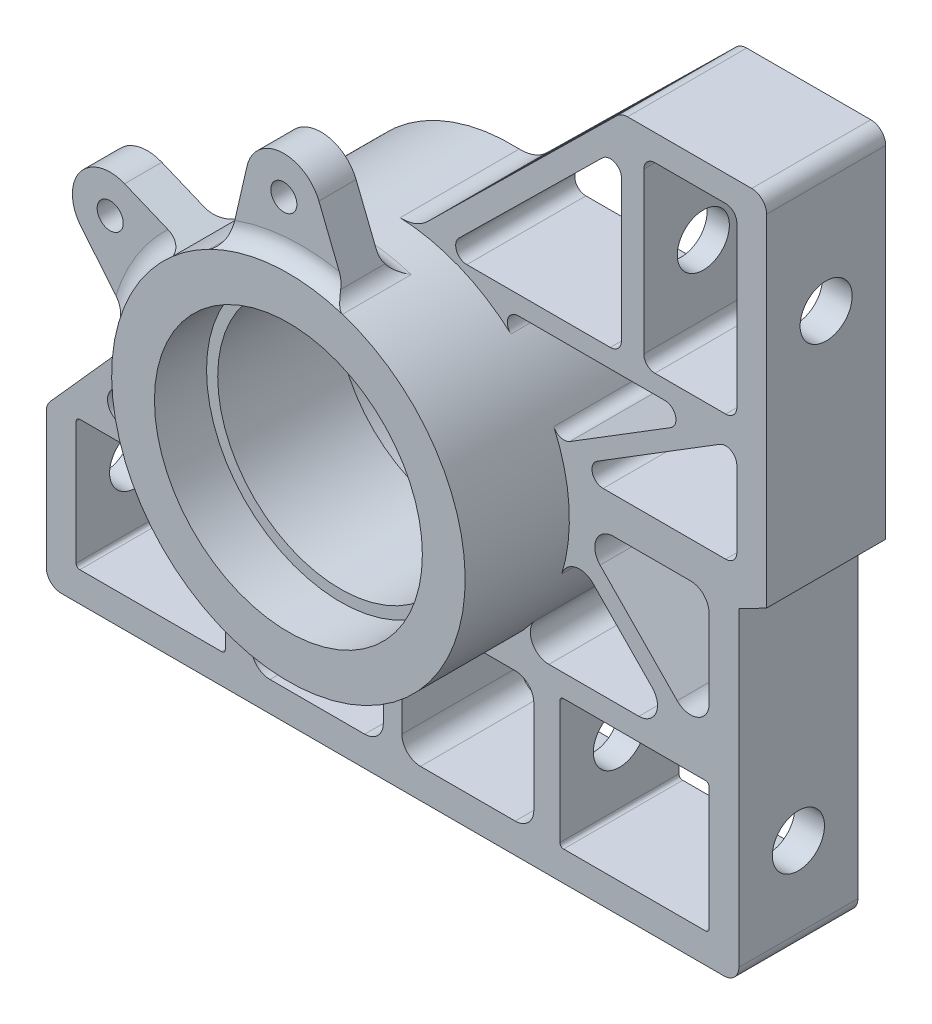
from build123d import *

# Parameters (mm, degrees)
SKETCH1_R                = 47.5
SKETCH1_R_2              = 36
BOSS_EXTRUDE1_DEPTH      = 60
BOSS_EXTRUDE2_DEPTH      = 32
FILLET4_R                = 10
CUT_EXTRUDE1_REACH       = 228.636
CUT_EXTRUDE2_DEPTH       = 64
BOSS_EXTRUDE4_DEPTH      = 16
BOSS_EXTRUDE4_DEPTH_BACK = 16
SKETCH6_R                = 36
SKETCH6_R_2              = 33
FILLET5_R                = 4
SKETCH8_R                = 10.15
SKETCH8_R_2              = 3.5
SKETCH8_R_3              = 10.147427291
BOSS_EXTRUDE6_DEPTH      = 10
FILLET12_R               = 5


with BuildPart() as part:
    # Sketch1 → Boss-Extrude1 (new body)
    with BuildSketch(Plane.XY):
        Circle(SKETCH1_R)
        Circle(SKETCH1_R_2, mode=Mode.SUBTRACT)
    extrude(amount=BOSS_EXTRUDE1_DEPTH)

    # Sketch2 → Boss-Extrude2 (add)
    with BuildSketch(Plane(origin=(0, 0, 0), x_dir=(-1, 0, 0), z_dir=(0, 0, -1))):
        with BuildLine():
            ThreePointArc((-93.05, -81.5), (-91.878427125, -84.328427125), (-89.05, -85.5))
            Line((-89.05, -85.5), (89.05, -85.5))
            ThreePointArc((89.05, -85.5), (91.878427125, -84.328427125), (93.05, -81.5))
            Line((93.05, -81.5), (93.05, -45.025163862))
            ThreePointArc((93.05, -45.025163862), (92.787529788, -43.60007752), (92.03456446, -42.362012536))
            Line((92.03456446, -42.362012536), (46.754425183, 8.382942549))
            ThreePointArc((46.754425183, 8.382942549), (47.313239142, 4.208016385), (47.5, 0))
            ThreePointArc((47.5, 0), (47.374726673, -3.447502376), (46.999567468, -6.876820327))
            ThreePointArc((46.999567468, -6.876820327), (46.85167785, -7.821143308), (46.684816708, -8.762299294))
            ThreePointArc((46.684816708, -8.762299294), (49.54342945, -5.646707476), (53.600734154, -6.837025804))
            Line((53.600734154, -6.837025804), (75.598988007, -31.49022744))
            ThreePointArc((75.598988007, -31.49022744), (76.264944422, -35.788523209), (72.614423548, -38.153378766))
            Line((72.614423548, -38.153378766), (49.95, -38.153378766))
            ThreePointArc((49.95, -38.153378766), (46.414466094, -36.688912672), (44.95, -33.153378766))
            Line((44.95, -33.153378766), (44.95, -15.354071121))
            ThreePointArc((44.95, -15.354071121), (44.659125276, -16.180622039), (44.353053198, -17.001666743))
            ThreePointArc((44.353053198, -17.001666743), (41.555802776, -23.00793897), (37.95, -28.566545118))
            Line((37.95, -28.566545118), (37.95, -72.533112291))
            ThreePointArc((37.95, -72.533112291), (36.47391714, -76.04722155), (32.950109644, -77.5))
            Line((32.950109644, -77.5), (7.5, -77.5))
            ThreePointArc((7.5, -77.5), (3.964466094, -76.035533906), (2.5, -72.5))
            Line((2.5, -72.5), (2.5, -47.434164903))
            ThreePointArc((2.5, -47.434164903), (0, -47.5), (-2.5, -47.434164903))
            Line((-2.5, -47.434164903), (-2.5, -72.5))
            ThreePointArc((-2.5, -72.5), (-3.964466094, -76.035533906), (-7.5, -77.5))
            Line((-7.5, -77.5), (-32.95, -77.5))
            ThreePointArc((-32.95, -77.5), (-36.485533906, -76.035533906), (-37.95, -72.5))
            Line((-37.95, -72.5), (-37.95, -47.5))
            ThreePointArc((-37.95, -47.5), (-36.485533906, -43.964466094), (-32.95, -42.5))
            Line((-32.95, -42.5), (-21.213203436, -42.5))
            ThreePointArc((-21.213203436, -42.5), (-27.890794752, -38.449363689), (-33.814356436, -33.359246077))
            ThreePointArc((-33.814356436, -33.359246077), (-35.989283345, -31.000346519), (-38, -28.5))
            ThreePointArc((-38, -28.5), (-37.527864045, -33.736067977), (-42, -36.5))
            Line((-42, -36.5), (-66.181051688, -36.5))
            ThreePointArc((-66.181051688, -36.5), (-70.789386546, -33.439909749), (-69.756953175, -28.005299934))
            Line((-69.756953175, -28.005299934), (-53.827303838, -11.705515781))
            ThreePointArc((-53.827303838, -11.705515781), (-49.062450426, -10.343633374), (-45.465554508, -13.752576243))
            ThreePointArc((-45.465554508, -13.752576243), (-47.40106961, 3.06408221), (-43.316596976, 19.491598868))
            ThreePointArc((-43.316596976, 19.491598868), (-45.175045505, 17.853800656), (-47.631663446, 18.171986466))
            Line((-47.631663446, 18.171986466), (-74.728376751, 34.949339249))
            ThreePointArc((-74.728376751, 34.949339249), (-76.034574712, 38.320980434), (-73.149095354, 40.5))
            Line((-73.149095354, 40.5), (-33.823069051, 40.5))
            ThreePointArc((-33.823069051, 40.5), (-31.022786179, 38.576297283), (-31.81377782, 35.272277228))
            ThreePointArc((-31.81377782, 35.272277228), (-19.902247401, 43.129462649), (-6.19459775, 47.094341048))
            Line((-6.19459775, 47.094341048), (-60.332534166, 100.351527239))
            ThreePointArc((-60.332534166, 100.351527239), (-61.622103232, 101.201763698), (-63.137670955, 101.5))
            Line((-63.137670955, 101.5), (-96.5, 101.5))
            ThreePointArc((-96.5, 101.5), (-99.328427125, 100.328427125), (-100.5, 97.5))
            Line((-100.5, 97.5), (-100.5, 5.848055119))
            Line((-100.5, 5.848055119), (-93.05, 1.964063449))
            Line((-93.05, 1.964063449), (-93.05, -81.5))
        make_face()
        with BuildLine():
            Line((-45.95, -77.5), (-84.05, -77.5))
            ThreePointArc((-84.05, -77.5), (-84.757106781, -77.207106781), (-85.05, -76.5))
            Line((-85.05, -76.5), (-85.05, -43.5))
            ThreePointArc((-85.05, -43.5), (-84.757106781, -42.792893219), (-84.05, -42.5))
            Line((-84.05, -42.5), (-45.95, -42.5))
            ThreePointArc((-45.95, -42.5), (-45.242893219, -42.792893219), (-44.95, -43.5))
            Line((-44.95, -43.5), (-44.95, -76.5))
            ThreePointArc((-44.95, -76.5), (-45.242893219, -77.207106781), (-45.95, -77.5))
        make_face(mode=Mode.SUBTRACT)
        with BuildLine():
            Line((-85.05, -24.230132308), (-85.05, -3.035936551))
            ThreePointArc((-85.05, -3.035936551), (-83.585533906, 0.499597355), (-80.05, 1.964063449))
            Line((-80.05, 1.964063449), (-59.337081151, 1.964063449))
            ThreePointArc((-59.337081151, 1.964063449), (-54.728746292, -1.096026802), (-55.761179663, -6.530636617))
            Line((-55.761179663, -6.530636617), (-76.474098513, -27.724832374))
            ThreePointArc((-76.474098513, -27.724832374), (-81.93686149, -28.860440475), (-85.05, -24.230132308))
        make_face(mode=Mode.SUBTRACT)
        with BuildLine():
            Line((84.05, -77.5), (45.95, -77.5))
            ThreePointArc((45.95, -77.5), (45.242893219, -77.207106781), (44.95, -76.5))
            Line((44.95, -76.5), (44.95, -43.5))
            ThreePointArc((44.95, -43.5), (45.242893219, -42.792893219), (45.95, -42.5))
            Line((45.95, -42.5), (84.05, -42.5))
            ThreePointArc((84.05, -42.5), (84.757106781, -42.792893219), (85.05, -43.5))
            Line((85.05, -43.5), (85.05, -76.5))
            ThreePointArc((85.05, -76.5), (84.757106781, -77.207106781), (84.05, -77.5))
        make_face(mode=Mode.SUBTRACT)
        with BuildLine():
            Line((-92.5, 14.727129287), (-92.5, 35.11400573))
            ThreePointArc((-92.5, 35.11400573), (-90.959821189, 37.734868583), (-87.920718603, 37.664666481))
            Line((-87.920718603, 37.664666481), (-54.994347362, 17.277790039))
            ThreePointArc((-54.994347362, 17.277790039), (-53.688149401, 13.906148853), (-56.573628759, 11.727129287))
            Line((-56.573628759, 11.727129287), (-89.5, 11.727129287))
            ThreePointArc((-89.5, 11.727129287), (-91.621320344, 12.605808944), (-92.5, 14.727129287))
        make_face(mode=Mode.SUBTRACT)
        with BuildLine():
            ThreePointArc((-92.5, 91.5), (-91.621320344, 93.621320344), (-89.5, 94.5))
            Line((-89.5, 94.5), (-70.5, 94.5))
            ThreePointArc((-70.5, 94.5), (-68.378679656, 93.621320344), (-67.5, 91.5))
            Line((-67.5, 91.5), (-67.5, 48.5))
            ThreePointArc((-67.5, 48.5), (-68.378679656, 46.378679656), (-70.5, 45.5))
            Line((-70.5, 45.5), (-89.5, 45.5))
            ThreePointArc((-89.5, 45.5), (-91.621320344, 46.378679656), (-92.5, 48.5))
            Line((-92.5, 48.5), (-92.5, 91.5))
        make_face(mode=Mode.SUBTRACT)
        with BuildLine():
            Line((-61.5, 48.5), (-61.5, 86.425000621))
            ThreePointArc((-61.5, 86.425000621), (-59.6594055, 89.191908442), (-56.396147408, 88.56364605))
            Line((-56.396147408, 88.56364605), (-17.843955319, 50.638645429))
            ThreePointArc((-17.843955319, 50.638645429), (-17.171485137, 47.363324208), (-19.947807911, 45.5))
            Line((-19.947807911, 45.5), (-58.5, 45.5))
            ThreePointArc((-58.5, 45.5), (-60.621320344, 46.378679656), (-61.5, 48.5))
        make_face(mode=Mode.SUBTRACT)
    extrude(amount=-BOSS_EXTRUDE2_DEPTH)

    # Fillet4
    fillet4_edges = [part.edges().sort_by_distance(p)[0] for p in [
        (6.19459775, 47.094341048, 16),
    ]]
    fillet(fillet4_edges, radius=FILLET4_R)

    # Cut-Extrude1: up to this face of the body (flat: up to its plane)
    cut_extrude1_end = Plane(part.part.faces().sort_by_distance((61.5, 67.46250031, 16))[0])
    # Sketch4 → Cut-Extrude1 (cut, up to the picked face)
    with BuildSketch(Plane(origin=(100.5, 0, 0), x_dir=(0, 0, -1), z_dir=(1, 0, 0)), mode=Mode.PRIVATE) as cut_extrude1_sk1:
        with BuildLine():
            ThreePointArc((-9, 67), (-11.050252532, 71.949747468), (-16, 74))
            Line((-16, 74), (-16, 60))
            ThreePointArc((-16, 60), (-11.050252532, 62.050252532), (-9, 67))
        make_face()
    cut_extrude1_tool1 = split(extrude(cut_extrude1_sk1.sketch, amount=-CUT_EXTRUDE1_REACH, mode=Mode.PRIVATE), bisect_by=cut_extrude1_end, keep=Keep.BOTH, mode=Mode.PRIVATE)
    # Sketch4 → Cut-Extrude1 (cut, up to the picked face)
    with BuildSketch(Plane(origin=(100.5, 0, 0), x_dir=(0, 0, -1), z_dir=(1, 0, 0)), mode=Mode.PRIVATE) as cut_extrude1_sk2:
        with BuildLine():
            Line((-16, 60), (-16, 74))
            ThreePointArc((-16, 74), (-23, 67), (-16, 60))
        make_face()
    cut_extrude1_tool2 = split(extrude(cut_extrude1_sk2.sketch, amount=-CUT_EXTRUDE1_REACH, mode=Mode.PRIVATE), bisect_by=cut_extrude1_end, keep=Keep.BOTH, mode=Mode.PRIVATE)
    # Sketch4 → Cut-Extrude1 (cut, up to the picked face)
    with BuildSketch(Plane(origin=(100.5, 0, 0), x_dir=(0, 0, -1), z_dir=(1, 0, 0)), mode=Mode.PRIVATE) as cut_extrude1_sk3:
        with BuildLine():
            ThreePointArc((-9, 67), (-11.050252532, 71.949747468), (-16, 74))
            Line((-16, 74), (-16, 60))
            ThreePointArc((-16, 60), (-11.050252532, 62.050252532), (-9, 67))
        make_face()
    cut_extrude1_tool3 = split(extrude(cut_extrude1_sk3.sketch, amount=-CUT_EXTRUDE1_REACH, mode=Mode.PRIVATE), bisect_by=cut_extrude1_end, keep=Keep.BOTH, mode=Mode.PRIVATE)
    # Sketch4 → Cut-Extrude1 (cut, up to the picked face)
    with BuildSketch(Plane(origin=(100.5, 0, 0), x_dir=(0, 0, -1), z_dir=(1, 0, 0)), mode=Mode.PRIVATE) as cut_extrude1_sk4:
        with BuildLine():
            Line((-16, 60), (-16, 74))
            ThreePointArc((-16, 74), (-23, 67), (-16, 60))
        make_face()
    cut_extrude1_tool4 = split(extrude(cut_extrude1_sk4.sketch, amount=-CUT_EXTRUDE1_REACH, mode=Mode.PRIVATE), bisect_by=cut_extrude1_end, keep=Keep.BOTH, mode=Mode.PRIVATE)
    add(cut_extrude1_tool1.solids().sort_by(Axis((100.5, 67, 13.029108), (-1, 0, 0)))[0], mode=Mode.SUBTRACT)
    add(cut_extrude1_tool2.solids().sort_by(Axis((100.5, 67, 18.970892), (-1, 0, 0)))[0], mode=Mode.SUBTRACT)
    add(cut_extrude1_tool3.solids().sort_by(Axis((100.5, 67, 13.029108), (-1, 0, 0)))[0], mode=Mode.SUBTRACT)
    add(cut_extrude1_tool4.solids().sort_by(Axis((100.5, 67, 18.970892), (-1, 0, 0)))[0], mode=Mode.SUBTRACT)

    # Sketch5 → Cut-Extrude2 (cut)
    with BuildSketch(Plane(origin=(93.05, 0, 0), x_dir=(0, 0, -1), z_dir=(1, 0, 0))):
        with BuildLine():
            ThreePointArc((-9, -60), (-11.050252532, -55.050252532), (-16, -53))
            Line((-16, -53), (-16, -67))
            ThreePointArc((-16, -67), (-11.050252532, -64.949747468), (-9, -60))
        make_face()
        with BuildLine():
            Line((-16, -67), (-16, -53))
            ThreePointArc((-16, -53), (-23, -60), (-16, -67))
        make_face()
    cut_extrude2 = extrude(amount=-CUT_EXTRUDE2_DEPTH, mode=Mode.SUBTRACT)

    # Mirror1: Cut-Extrude2 across plane
    add(cut_extrude2.mirror(Plane(origin=(0, 0, 0), x_dir=(0, 0, 1), z_dir=(1, 0, 0))), mode=Mode.SUBTRACT)

    # Sketch6 → Boss-Extrude4 (add, two sides: drawn at the far end of the back side and taken through both)
    with BuildSketch(Plane(origin=(0, 0, 30), x_dir=(-1, 0, 0), z_dir=(0, 0, -1)).offset(-BOSS_EXTRUDE4_DEPTH_BACK)):
        Circle(SKETCH6_R)
        Circle(SKETCH6_R_2, mode=Mode.SUBTRACT)
    extrude(amount=BOSS_EXTRUDE4_DEPTH + BOSS_EXTRUDE4_DEPTH_BACK)

    # Fillet5
    fillet5_edges = [part.edges().sort_by_distance(p)[0] for p in [
        (2.5, -47.434164903, 16),
        (-2.5, -47.434164903, 16),
        (-37.95, -28.566545118, 16),
    ]]
    fillet(fillet5_edges, radius=FILLET5_R)

    # Sketch8 → Boss-Extrude6 (add)
    # profile 1 of 4: a face of its own
    with BuildSketch(Plane.XY.offset(56.5)):
        with BuildLine():
            Line((-59.222959204, 26.990249925), (-45.766093405, 10.69881743))
            ThreePointArc((-45.766093405, 10.69881743), (-40.131467131, 24.463551376), (-30.477936689, 35.778420524))
            Line((-30.477936689, 35.778420524), (-47.514583839, 42.832199703))
            ThreePointArc((-47.514583839, 42.832199703), (-42.958408459, 39.093911337), (-41.247396932, 33.45423284))
            ThreePointArc((-41.247396932, 33.45423284), (-47.962790482, 23.903003676), (-59.222959204, 26.990249925))
        make_face()
    # profile 2 of 4: a face of its own
    with BuildSketch(Plane.XY.offset(56.5)):
        with Locations((-51.397396932, 33.45423284)):
            Circle(SKETCH8_R)
        with Locations((-51.397396932, 33.45423284)):
            Circle(SKETCH8_R_2, mode=Mode.SUBTRACT)
    # profile 3 of 4: a face of its own
    with BuildSketch(Plane.XY.offset(56.5)):
        with BuildLine():
            Line((12.543621914, 45.295226562), (4.69463362, 64.913008121))
            ThreePointArc((4.69463362, 64.913008121), (5.237546502, 63.062937165), (5.420721845, 61.143571714))
            ThreePointArc((5.420721845, 61.143571714), (-5.872365961, 51.061025279), (-14.615438985, 63.420242442))
            Line((-14.615438985, 63.420242442), (-19.356084527, 42.829218903))
            ThreePointArc((-19.356084527, 42.829218903), (-3.622528144, 46.860188752), (12.543621914, 45.295226562))
        make_face()
    # profile 4 of 4: a face of its own
    with BuildSketch(Plane.XY.offset(56.5)):
        with Locations((-4.726705446, 61.143571714)):
            Circle(SKETCH8_R_3)
        with Locations((-4.726705446, 61.143571714)):
            Circle(SKETCH8_R_2, mode=Mode.SUBTRACT)
    extrude(amount=-BOSS_EXTRUDE6_DEPTH)

    # Fillet12
    # the kernel refuses this fillet: 5 mm, written as the material it adds along each edge
    with BuildSketch(Plane(origin=(0, 0, 56.5), x_dir=(-0.9999100275836823, -0.01341405000734196, 0), z_dir=(0.01341405000734196, -0.9999100275836823, 0))) as fillet12_piece_1_section:
        with BuildLine():
            CenterArc((52.269696007, -5), FILLET12_R, 90, 72.542396876)
            Line((52.269696007, 0), (47.5, 0))
            Line((47.5, 0), (47.5, -3.5))
        make_face()
    fillet12_piece_1 = revolve(axis=Axis((0, 0, 56.5), (0, 0, -1)), revolution_arc=64.418761462, mode=Mode.PRIVATE)
    fillet12_piece_1 = split(fillet12_piece_1, bisect_by=Plane(origin=(8.185621098, 19.770329466, 56.5), z_dir=(-0.3825431163707949, -0.9239376408163705, 0)), keep=Keep.TOP, mode=Mode.PRIVATE)
    fillet12_piece_1 = split(fillet12_piece_1, bisect_by=Plane(origin=(-21.951486711, -18.13212011, 56.5), z_dir=(0.7709913568808224, 0.6368456073610529, 0)), keep=Keep.TOP, mode=Mode.PRIVATE)
    add(fillet12_piece_1)
    with BuildSketch(Plane(origin=(-46.165094135, 11.181864044, 56.5), x_dir=(-0.2117403626960808, -0.9773259532036036, 0), z_dir=(0, 0, -1)), Plane(origin=(-19.215517387, 43.439773153, 56.5), x_dir=(-0.9044296640241518, -0.42662276408222727, 0), z_dir=(0, 0, -1))) as fillet12_piece_2:
        with BuildLine():
            CenterArc((2.428025599, 4.998525956), FILLET12_R, 218.218634015, 50.390073067)
            Line((-1.50025305, 1.905206241), (0, 0))
            ThreePointArc((0, 0), (1.153312159, 0.014003421), (2.306624319, 0))
        make_face()
    extrude(amount=10)
    with BuildSketch(Plane(origin=(0, 0, 46.5), x_dir=(-0.9996739618401788, -0.02553370358488828, 0), z_dir=(0.02553370358488828, -0.9996739618401788, 0))) as fillet12_piece_3_section:
        with BuildLine():
            CenterArc((47.5 + FILLET12_R, FILLET12_R), FILLET12_R, 180, 90)
            Line((47.5 + FILLET12_R, 0), (47.5, 0))
            Line((47.5, 0), (47.5, FILLET12_R))
        make_face()
    fillet12_piece_3 = revolve(axis=Axis((0, 0, 46.5), (0, 0, -1)), revolution_arc=65.80784339, mode=Mode.PRIVATE)
    fillet12_piece_3 = split(fillet12_piece_3, bisect_by=Plane(origin=(8.185621098, 19.770329466, 46.5), z_dir=(-0.3825431163707949, -0.9239376408163705, 0)), keep=Keep.TOP, mode=Mode.PRIVATE)
    fillet12_piece_3 = split(fillet12_piece_3, bisect_by=Plane(origin=(-21.951486711, -18.13212011, 46.5), z_dir=(0.7709913568808224, 0.6368456073610529, 0)), keep=Keep.TOP, mode=Mode.PRIVATE)
    add(fillet12_piece_3)
    with BuildSketch(Plane(origin=(0, 0, 56.5), x_dir=(-0.619046623167299, 0.7853542374910598, 0), z_dir=(-0.7853542374910598, -0.619046623167299, 0))) as fillet12_piece_4_section:
        with BuildLine():
            CenterArc((52.269696007, -5), FILLET12_R, 90, 72.542396876)
            Line((52.269696007, 0), (47.5, 0))
            Line((47.5, 0), (47.5, -3.5))
        make_face()
    fillet12_piece_4 = revolve(axis=Axis((0, 0, 56.5), (0, 0, -1)), revolution_arc=67.652174246, mode=Mode.PRIVATE)
    fillet12_piece_4 = split(fillet12_piece_4, bisect_by=Plane(origin=(-27.745921683, 6.387908773, 56.5), z_dir=(0.9745064690951787, -0.22435940294903534, 0)), keep=Keep.TOP, mode=Mode.PRIVATE)
    fillet12_piece_4 = split(fillet12_piece_4, bisect_by=Plane(origin=(26.434500922, 10.576327791, 56.5), z_dir=(-0.9284460775917649, -0.37146720044233605, 0)), keep=Keep.TOP, mode=Mode.PRIVATE)
    add(fillet12_piece_4)
    with BuildSketch(Plane(origin=(12.310887822, 45.87692275, 56.5), x_dir=(0.9592523435499558, -0.28255077666486356, 0), z_dir=(0, 0, -1))) as fillet12_piece_5:
        with BuildLine():
            CenterArc((2.428025599, -4.998525956), FILLET12_R, 91.391292918, 50.390073067)
            Line((-1.50025305, -1.905206241), (0, 0))
            ThreePointArc((0, 0), (1.153312159, -0.014003421), (2.306624319, 0))
        make_face()
    extrude(amount=10)
    with BuildSketch(Plane(origin=(0, 0, 46.5), x_dir=(-0.6285211057422533, 0.7777925299439017, 0), z_dir=(-0.7777925299439017, -0.6285211057422533, 0))) as fillet12_piece_6_section:
        with BuildLine():
            CenterArc((47.5 + FILLET12_R, FILLET12_R), FILLET12_R, 180, 90)
            Line((47.5 + FILLET12_R, 0), (47.5, 0))
            Line((47.5, 0), (47.5, FILLET12_R))
        make_face()
    fillet12_piece_6 = revolve(axis=Axis((0, 0, 46.5), (0, 0, -1)), revolution_arc=69.041272771, mode=Mode.PRIVATE)
    fillet12_piece_6 = split(fillet12_piece_6, bisect_by=Plane(origin=(-27.745921683, 6.387908773, 46.5), z_dir=(0.9745064690951787, -0.22435940294903534, 0)), keep=Keep.TOP, mode=Mode.PRIVATE)
    fillet12_piece_6 = split(fillet12_piece_6, bisect_by=Plane(origin=(26.434500922, 10.576327791, 46.5), z_dir=(-0.9284460775917649, -0.37146720044233605, 0)), keep=Keep.TOP, mode=Mode.PRIVATE)
    add(fillet12_piece_6)
    with BuildSketch(Plane(origin=(0, 0, 56.5), x_dir=(-0.9999100275836823, -0.01341405000734196, 0), z_dir=(0.01341405000734196, -0.9999100275836823, 0))) as fillet12_piece_7a_section:
        with BuildLine():
            CenterArc((52.269696007, -5), FILLET12_R, 90, 72.542396876)
            Line((52.269696007, 0), (47.5, 0))
            Line((47.5, 0), (47.5, -3.5))
        make_face()
    fillet12_piece_7a = revolve(axis=Axis((0, 0, 56.5), (0, 0, -1)), revolution_arc=64.418761462, mode=Mode.PRIVATE)
    fillet12_piece_7a = split(fillet12_piece_7a, bisect_by=Plane(origin=(-21.951486711, -18.13212011, 56.5), z_dir=(-0.7709913568808224, -0.6368456073610529, 0)), keep=Keep.TOP, mode=Mode.PRIVATE)
    with BuildSketch(Plane(origin=(-46.165094135, 11.181864044, 62.562471668), x_dir=(-0.2117403626960808, -0.9773259532036036, 0), z_dir=(0, 0, -1))) as fillet12_piece_7b_section:
        with BuildLine():
            CenterArc((2.428025599, 4.998525956), FILLET12_R, 218.218634015, 50.390073067)
            Line((-1.50025305, 1.905206241), (0, 0))
            ThreePointArc((0, 0), (1.153312159, 0.014003421), (2.306624319, 0))
        make_face()
    fillet12_piece_7b = extrude(amount=16.062471668, mode=Mode.PRIVATE)
    fillet12_piece_7b = split(fillet12_piece_7b, bisect_by=Plane(origin=(-46.165094135, 11.181864044, 60), z_dir=(0, 0, -1)), keep=Keep.TOP, mode=Mode.PRIVATE)
    fillet12_piece_7b = split(fillet12_piece_7b, bisect_by=Plane(origin=(-46.165094135, 11.181864044, 56.5), z_dir=(0, 0, 1)), keep=Keep.TOP, mode=Mode.PRIVATE)
    fillet12_piece_7 = fillet12_piece_7a & fillet12_piece_7b
    add(fillet12_piece_7)
    with BuildSketch(Plane(origin=(0, 0, 46.5), x_dir=(-0.9996739618401788, -0.02553370358488828, 0), z_dir=(0.02553370358488828, -0.9996739618401788, 0))) as fillet12_piece_8a_section:
        with BuildLine():
            CenterArc((47.5 + FILLET12_R, FILLET12_R), FILLET12_R, 180, 90)
            Line((47.5 + FILLET12_R, 0), (47.5, 0))
            Line((47.5, 0), (47.5, FILLET12_R))
        make_face()
    fillet12_piece_8a = revolve(axis=Axis((0, 0, 46.5), (0, 0, -1)), revolution_arc=65.80784339, mode=Mode.PRIVATE)
    fillet12_piece_8a = split(fillet12_piece_8a, bisect_by=Plane(origin=(-21.951486711, -18.13212011, 46.5), z_dir=(-0.7709913568808224, -0.6368456073610529, 0)), keep=Keep.TOP, mode=Mode.PRIVATE)
    with BuildSketch(Plane(origin=(-46.165094135, 11.181864044, 56.5), x_dir=(-0.2117403626960808, -0.9773259532036036, 0), z_dir=(0, 0, -1))) as fillet12_piece_8b_section:
        with BuildLine():
            CenterArc((2.428025599, 4.998525956), FILLET12_R, 218.218634015, 50.390073067)
            Line((-1.50025305, 1.905206241), (0, 0))
            ThreePointArc((0, 0), (1.153312159, 0.014003421), (2.306624319, 0))
        make_face()
    fillet12_piece_8b = extrude(amount=16.062471668, mode=Mode.PRIVATE)
    fillet12_piece_8b = split(fillet12_piece_8b, bisect_by=Plane(origin=(-46.165094135, 11.181864044, 46.5), z_dir=(0, 0, -1)), keep=Keep.TOP, mode=Mode.PRIVATE)
    fillet12_piece_8 = fillet12_piece_8a & fillet12_piece_8b
    add(fillet12_piece_8)
    with BuildSketch(Plane(origin=(0, 0, 56.5), x_dir=(-0.619046623167299, 0.7853542374910598, 0), z_dir=(-0.7853542374910598, -0.619046623167299, 0))) as fillet12_piece_9a_section:
        with BuildLine():
            CenterArc((52.269696007, -5), FILLET12_R, 90, 72.542396876)
            Line((52.269696007, 0), (47.5, 0))
            Line((47.5, 0), (47.5, -3.5))
        make_face()
    fillet12_piece_9a = revolve(axis=Axis((0, 0, 56.5), (0, 0, -1)), revolution_arc=67.652174246, mode=Mode.PRIVATE)
    fillet12_piece_9a = split(fillet12_piece_9a, bisect_by=Plane(origin=(-27.745921683, 6.387908773, 56.5), z_dir=(-0.9745064690951787, 0.22435940294903534, 0)), keep=Keep.TOP, mode=Mode.PRIVATE)
    with BuildSketch(Plane(origin=(-19.215517387, 43.439773153, 62.562471668), x_dir=(-0.9044296640241518, -0.42662276408222727, 0), z_dir=(0, 0, -1))) as fillet12_piece_9b_section:
        with BuildLine():
            CenterArc((2.428025599, 4.998525956), FILLET12_R, 218.218634015, 50.390073067)
            Line((-1.50025305, 1.905206241), (0, 0))
            ThreePointArc((0, 0), (1.153312159, 0.014003421), (2.306624319, 0))
        make_face()
    fillet12_piece_9b = extrude(amount=16.062471668, mode=Mode.PRIVATE)
    fillet12_piece_9b = split(fillet12_piece_9b, bisect_by=Plane(origin=(-19.215517387, 43.439773153, 60), z_dir=(0, 0, -1)), keep=Keep.TOP, mode=Mode.PRIVATE)
    fillet12_piece_9b = split(fillet12_piece_9b, bisect_by=Plane(origin=(-19.215517387, 43.439773153, 56.5), z_dir=(0, 0, 1)), keep=Keep.TOP, mode=Mode.PRIVATE)
    fillet12_piece_9 = fillet12_piece_9a & fillet12_piece_9b
    add(fillet12_piece_9)
    with BuildSketch(Plane(origin=(0, 0, 56.5), x_dir=(-0.619046623167299, 0.7853542374910598, 0), z_dir=(-0.7853542374910598, -0.619046623167299, 0))) as fillet12_piece_10a_section:
        with BuildLine():
            CenterArc((52.269696007, -5), FILLET12_R, 90, 72.542396876)
            Line((52.269696007, 0), (47.5, 0))
            Line((47.5, 0), (47.5, -3.5))
        make_face()
    fillet12_piece_10a = revolve(axis=Axis((0, 0, 56.5), (0, 0, -1)), revolution_arc=67.652174246, mode=Mode.PRIVATE)
    fillet12_piece_10a = split(fillet12_piece_10a, bisect_by=Plane(origin=(26.434500922, 10.576327791, 56.5), z_dir=(0.9284460775917649, 0.37146720044233605, 0)), keep=Keep.TOP, mode=Mode.PRIVATE)
    with BuildSketch(Plane(origin=(12.310887822, 45.87692275, 62.562471668), x_dir=(0.9592523435499558, -0.28255077666486356, 0), z_dir=(0, 0, -1))) as fillet12_piece_10b_section:
        with BuildLine():
            CenterArc((2.428025599, -4.998525956), FILLET12_R, 91.391292918, 50.390073067)
            Line((-1.50025305, -1.905206241), (0, 0))
            ThreePointArc((0, 0), (1.153312159, -0.014003421), (2.306624319, 0))
        make_face()
    fillet12_piece_10b = extrude(amount=16.062471668, mode=Mode.PRIVATE)
    fillet12_piece_10b = split(fillet12_piece_10b, bisect_by=Plane(origin=(12.310887822, 45.87692275, 60), z_dir=(0, 0, -1)), keep=Keep.TOP, mode=Mode.PRIVATE)
    fillet12_piece_10b = split(fillet12_piece_10b, bisect_by=Plane(origin=(12.310887822, 45.87692275, 56.5), z_dir=(0, 0, 1)), keep=Keep.TOP, mode=Mode.PRIVATE)
    fillet12_piece_10 = fillet12_piece_10a & fillet12_piece_10b
    add(fillet12_piece_10)
    with BuildSketch(Plane(origin=(0, 0, 46.5), x_dir=(-0.6285211057422533, 0.7777925299439017, 0), z_dir=(-0.7777925299439017, -0.6285211057422533, 0))) as fillet12_piece_11a_section:
        with BuildLine():
            CenterArc((47.5 + FILLET12_R, FILLET12_R), FILLET12_R, 180, 90)
            Line((47.5 + FILLET12_R, 0), (47.5, 0))
            Line((47.5, 0), (47.5, FILLET12_R))
        make_face()
    fillet12_piece_11a = revolve(axis=Axis((0, 0, 46.5), (0, 0, -1)), revolution_arc=69.041272771, mode=Mode.PRIVATE)
    fillet12_piece_11a = split(fillet12_piece_11a, bisect_by=Plane(origin=(26.434500922, 10.576327791, 46.5), z_dir=(0.9284460775917649, 0.37146720044233605, 0)), keep=Keep.TOP, mode=Mode.PRIVATE)
    with BuildSketch(Plane(origin=(12.310887822, 45.87692275, 56.5), x_dir=(0.9592523435499558, -0.28255077666486356, 0), z_dir=(0, 0, -1))) as fillet12_piece_11b_section:
        with BuildLine():
            CenterArc((2.428025599, -4.998525956), FILLET12_R, 91.391292918, 50.390073067)
            Line((-1.50025305, -1.905206241), (0, 0))
            ThreePointArc((0, 0), (1.153312159, -0.014003421), (2.306624319, 0))
        make_face()
    fillet12_piece_11b = extrude(amount=16.062471668, mode=Mode.PRIVATE)
    fillet12_piece_11b = split(fillet12_piece_11b, bisect_by=Plane(origin=(12.310887822, 45.87692275, 46.5), z_dir=(0, 0, -1)), keep=Keep.TOP, mode=Mode.PRIVATE)
    fillet12_piece_11 = fillet12_piece_11a & fillet12_piece_11b
    add(fillet12_piece_11)
    with BuildSketch(Plane(origin=(-19.215517387, 43.439773153, 56.5), x_dir=(-0.9044296640241518, -0.42662276408222727, 0), z_dir=(0, 0, -1))) as fillet12_piece_12a_section:
        with BuildLine():
            CenterArc((2.428025599, 4.998525956), FILLET12_R, 218.218634015, 50.390073067)
            Line((-1.50025305, 1.905206241), (0, 0))
            ThreePointArc((0, 0), (1.153312159, 0.014003421), (2.306624319, 0))
        make_face()
    fillet12_piece_12a = extrude(amount=16.062471668, mode=Mode.PRIVATE)
    fillet12_piece_12a = split(fillet12_piece_12a, bisect_by=Plane(origin=(-19.215517387, 43.439773153, 46.5), z_dir=(0, 0, -1)), keep=Keep.TOP, mode=Mode.PRIVATE)
    with BuildSketch(Plane(origin=(0, 0, 46.5), x_dir=(-0.6285211057422533, 0.7777925299439017, 0), z_dir=(-0.7777925299439017, -0.6285211057422533, 0))) as fillet12_piece_12b_section:
        with BuildLine():
            CenterArc((47.5 + FILLET12_R, FILLET12_R), FILLET12_R, 180, 90)
            Line((47.5 + FILLET12_R, 0), (47.5, 0))
            Line((47.5, 0), (47.5, FILLET12_R))
        make_face()
    fillet12_piece_12b = revolve(axis=Axis((0, 0, 46.5), (0, 0, -1)), revolution_arc=69.041272771, mode=Mode.PRIVATE)
    fillet12_piece_12b = split(fillet12_piece_12b, bisect_by=Plane(origin=(-27.745921683, 6.387908773, 46.5), z_dir=(-0.9745064690951787, 0.22435940294903534, 0)), keep=Keep.TOP, mode=Mode.PRIVATE)
    fillet12_piece_12 = fillet12_piece_12a & fillet12_piece_12b
    add(fillet12_piece_12)


with BuildPart() as body_2:
    # Mirror2: mirrored copy
    add(part.part.mirror(Plane.XY.offset(86.5)))


solid = part.part
